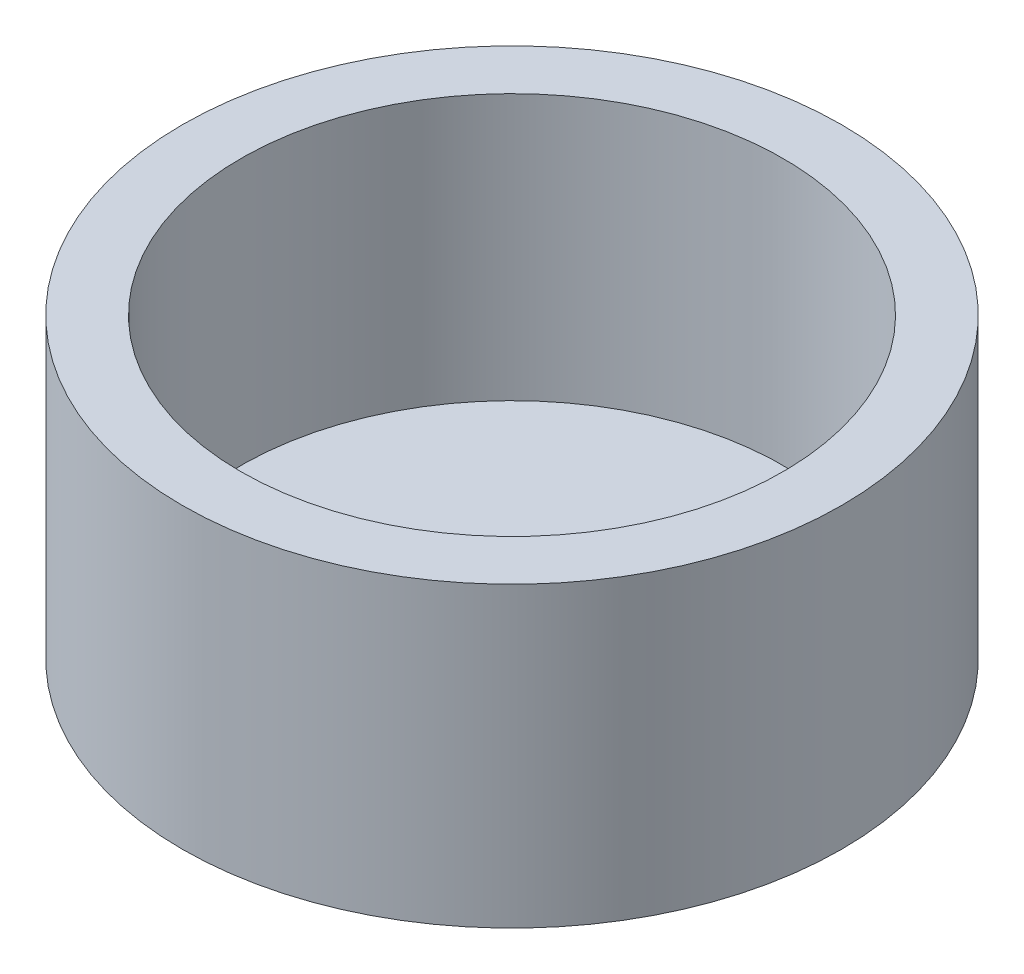
from build123d import *

# Parameters (mm, degrees)
SKETCH1_R           = 31
BOSS_EXTRUDE1_DEPTH = 3
SKETCH2_R           = 31
SKETCH2_R_2         = 25.5
BOSS_EXTRUDE2_DEPTH = 25
SKETCH4_R           = 9
CUT_EXTRUDE1_DEPTH  = 51.467811524


with BuildPart() as part:
    # Sketch1 → Boss-Extrude1 (new body)
    with BuildSketch(Plane(origin=(0, 0, 0), x_dir=(1, 0, 0), z_dir=(0, 1, 0))):
        Circle(SKETCH1_R)
    extrude(amount=BOSS_EXTRUDE1_DEPTH)

    # Sketch2 → Boss-Extrude2 (add)
    with BuildSketch(Plane(origin=(0, 3, 0), x_dir=(1, 0, 0), z_dir=(0, 1, 0))):
        Circle(SKETCH2_R)
        Circle(SKETCH2_R_2, mode=Mode.SUBTRACT)
    extrude(amount=BOSS_EXTRUDE2_DEPTH)

    # Sketch4 → Cut-Extrude1 (cut, through all)
    with BuildSketch(Plane(origin=(0, 3, 0), x_dir=(1, 0, 0), z_dir=(0, 1, 0))):
        Circle(SKETCH4_R)
    extrude(amount=-CUT_EXTRUDE1_DEPTH, mode=Mode.SUBTRACT)


solid = part.part
